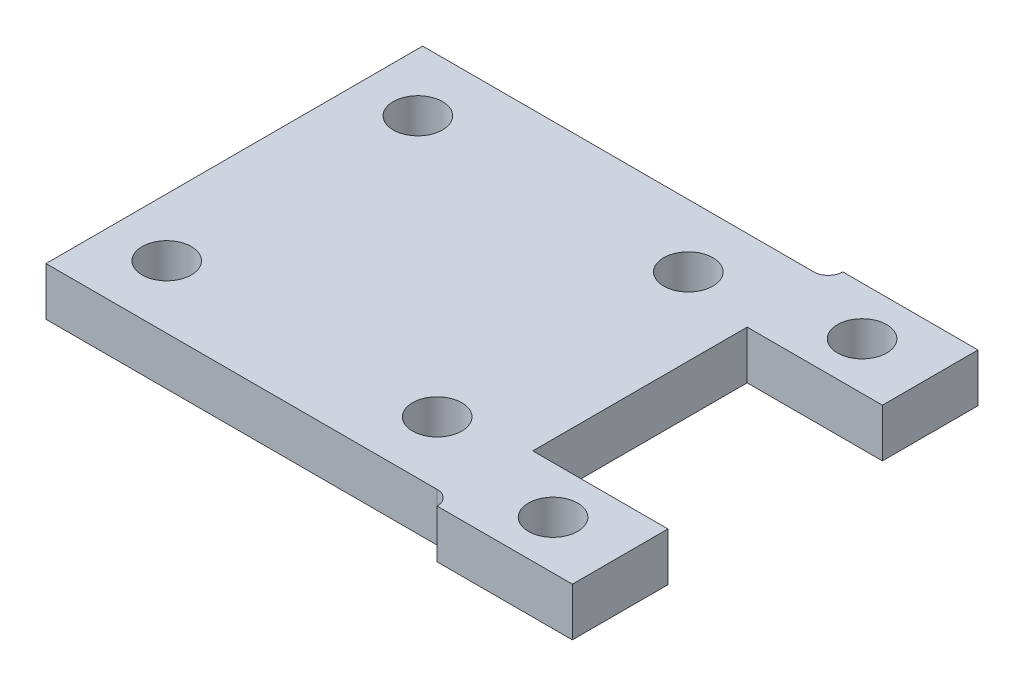
from build123d import *

# Parameters (mm, degrees)
SKETCH1_R           = 2.55
BOSS_EXTRUDE1_DEPTH = 5


with BuildPart() as part:
    # Sketch1 → Boss-Extrude1 (new body)
    with BuildSketch(Plane(origin=(0, 0, 0), x_dir=(1, 0, 0), z_dir=(0, 1, 0))):
        with BuildLine():
            Line((-20, -19.5), (20.506420366, -19.5))
            ThreePointArc((20.506420366, -19.5), (21.56000947, -19.936410896), (21.996420366, -20.99))
            Line((21.996420366, -20.99), (21.996420366, -21))
            Line((21.996420366, -21), (35.996420366, -21))
            Line((35.996420366, -21), (35.996420366, -20.133171497))
            Line((35.996420366, -20.133171497), (35.996420366, -11.1))
            Line((35.996420366, -11.1), (21.996420366, -11.1))
            Line((21.996420366, -11.1), (21.996420366, 11.1))
            Line((21.996420366, 11.1), (35.996420366, 11.1))
            Line((35.996420366, 11.1), (35.996420366, 18.866828503))
            Line((35.996420366, 18.866828503), (35.996420366, 21))
            Line((35.996420366, 21), (21.996420366, 21))
            Line((21.996420366, 21), (21.996420366, 20.99))
            ThreePointArc((21.996420366, 20.99), (21.56000947, 19.936410896), (20.506420366, 19.5))
            Line((20.506420366, 19.5), (-20, 19.5))
            Line((-20, 19.5), (-20, -19.5))
        make_face()
        with Locations((-14, 13)):
            Circle(SKETCH1_R, mode=Mode.SUBTRACT)
        with Locations((14, 13)):
            Circle(SKETCH1_R, mode=Mode.SUBTRACT)
        with Locations((14, -13)):
            Circle(SKETCH1_R, mode=Mode.SUBTRACT)
        with Locations((-14, -13)):
            Circle(SKETCH1_R, mode=Mode.SUBTRACT)
        with Locations((28.996420366, 16)):
            Circle(SKETCH1_R, mode=Mode.SUBTRACT)
        with Locations((28.996420366, -16)):
            Circle(SKETCH1_R, mode=Mode.SUBTRACT)
    extrude(amount=BOSS_EXTRUDE1_DEPTH)


solid = part.part
